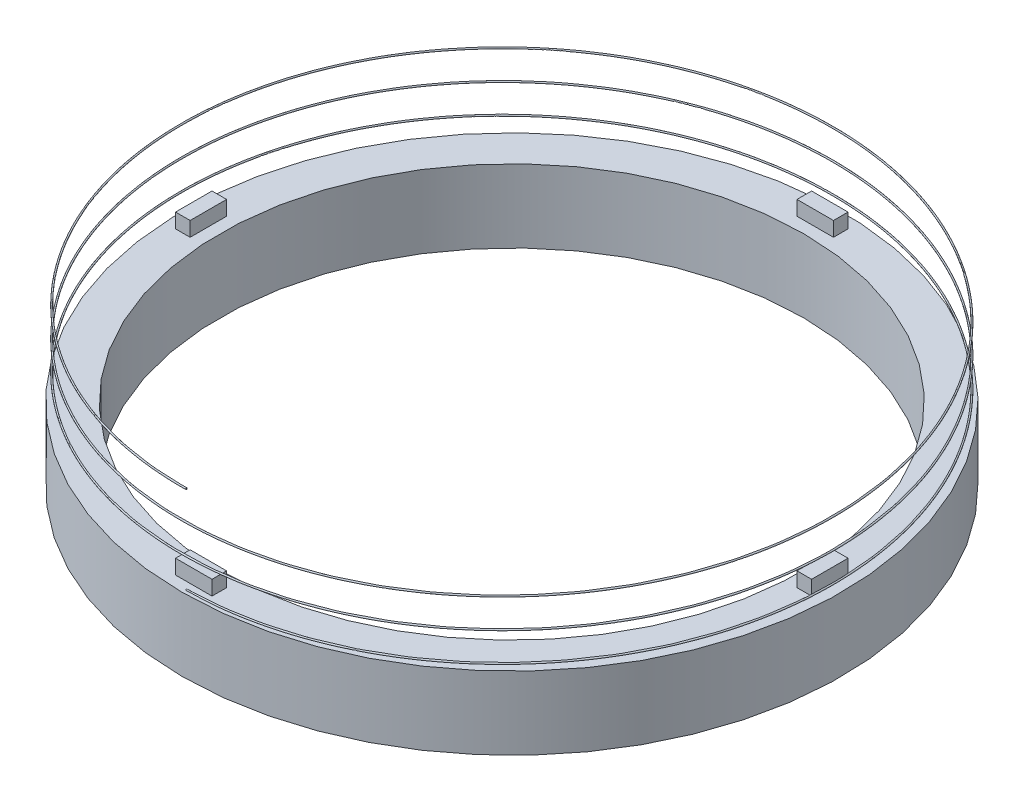
from build123d import *

# Parameters (mm, degrees)
SKETCH2_R           = 22.6
SKETCH2_R_2         = 20
BOSS_EXTRUDE2_DEPTH = 5
SKETCH3_W           = 2.5
SKETCH3_H           = 1
BOSS_EXTRUDE3_DEPTH = 1
CIRPATTERN1_COUNT   = 4
SWEEP2_PITCH        = 2


with BuildPart() as part:
    # Sketch2 → Boss-Extrude2 (new body)
    with BuildSketch(Plane(origin=(0, 0, 0), x_dir=(1, 0, 0), z_dir=(0, 1, 0))):
        with Locations(Location((0, 0, 0), (0, 0, 270))):
            Circle(SKETCH2_R)
        with Locations(Location((0, 0, 0), (0, 0, 270))):
            Circle(SKETCH2_R_2, mode=Mode.SUBTRACT)
    extrude(amount=BOSS_EXTRUDE2_DEPTH)

    # Sketch3 → Boss-Extrude3 (add)
    with BuildSketch(Plane(origin=(0, 5, 0), x_dir=(1, 0, 0), z_dir=(0, 1, 0))):
        with Locations((0, -21.3)):
            Rectangle(SKETCH3_W, SKETCH3_H)
    boss_extrude3 = extrude(amount=BOSS_EXTRUDE3_DEPTH)

    # CirPattern1: Boss-Extrude3 ×4 about axis
    cirpattern1_axis = Axis((0, 0, 0), (0, 1, 0))
    for i in range(1, CIRPATTERN1_COUNT):
        add(boss_extrude3.rotate(cirpattern1_axis, i * 360 / CIRPATTERN1_COUNT))

    # Sweep2: the profile of Sweep2 profile screwed along a right-hand helix of 3 turns, 10 arcs to a turn; built about Z, then put on its axis
    sweep2_z = Axis((0, 0, 0), (0, 0, 1))
    sweep2_corners = [(22.3, -0.000713627, 0.049994907), (22.35, 0, 0), (22.3, 0.000713627, -0.049994907), (22.25, 0, 0)]
    with BuildLine(mode=Mode.PRIVATE) as sweep2_profile:
        ThreePointArc((22.3, -0.000713627, 0.049994907), (22.335355339, -0.00050461, 0.035351738), (22.35, 0, 0))
        ThreePointArc((22.35, 0, 0), (22.335355339, 0.00050461, -0.035351738), (22.3, 0.000713627, -0.049994907))
        ThreePointArc((22.3, 0.000713627, -0.049994907), (22.264644661, 0.00050461, -0.035351738), (22.25, 0, 0))
        ThreePointArc((22.25, 0, 0), (22.264644661, -0.00050461, 0.035351738), (22.3, -0.000713627, 0.049994907))
    sweep2_cap = Face(sweep2_profile.wire())
    sweep2_arcs = [((22.3, -0.000713627, 0.049994907), (22.35, -0.000713627, 0.049994907), (22.35, 0, 0), (1, 0.7071067811865475, 1)), ((22.35, 0, 0), (22.35, 0.000713627, -0.049994907), (22.3, 0.000713627, -0.049994907), (1, 0.7071067811865475, 1)), ((22.3, 0.000713627, -0.049994907), (22.25, 0.000713627, -0.049994907), (22.25, 0, 0), (1, 0.7071067811865475, 1)), ((22.25, 0, 0), (22.25, -0.000713627, 0.049994907), (22.3, -0.000713627, 0.049994907), (1, 0.7071067811865475, 1))]  # start, shoulder, end, weights
    sweep2_turn_angles = [0, 18, 36, 54, 72, 90, 108, 126, 144, 162, 180, 198, 216, 234, 252, 270, 288, 306, 324, 342, 360]
    sweep2_turn_weights = [1, 0.9510565162951535, 1, 0.9510565162951535, 1, 0.9510565162951535, 1, 0.9510565162951535, 1, 0.9510565162951535, 1, 0.9510565162951535, 1, 0.9510565162951535, 1, 0.9510565162951535, 1, 0.9510565162951535, 1, 0.9510565162951535, 1]
    sweep2_turn_sides = [Face.make_bezier_surface([[Vector(p[j][0], p[j][1], 0).rotate(sweep2_z, sweep2_turn_angles[2 * i + k]) / sweep2_turn_weights[2 * i + k] + Vector(0, 0, p[j][2] + SWEEP2_PITCH * sweep2_turn_angles[2 * i + k] / 360) for k in range(3)] for j in range(3)], [[p[3][j] * sweep2_turn_weights[2 * i + k] for k in range(3)] for j in range(3)]) for p in sweep2_arcs for i in range(10)]
    sweep2 = Plane(origin=(0, 5, 0), x_dir=(0, 0, 1), z_dir=(0, 1, 0)) * Solid(Shell([*[p.moved(Location((0, 0, SWEEP2_PITCH * i))) for i in range(3) for p in sweep2_turn_sides], sweep2_cap, sweep2_cap.rotate(sweep2_z, 1080).moved(Location((0, 0, SWEEP2_PITCH * 1080 / 360)))]))
    add(sweep2)


solid = part.part
